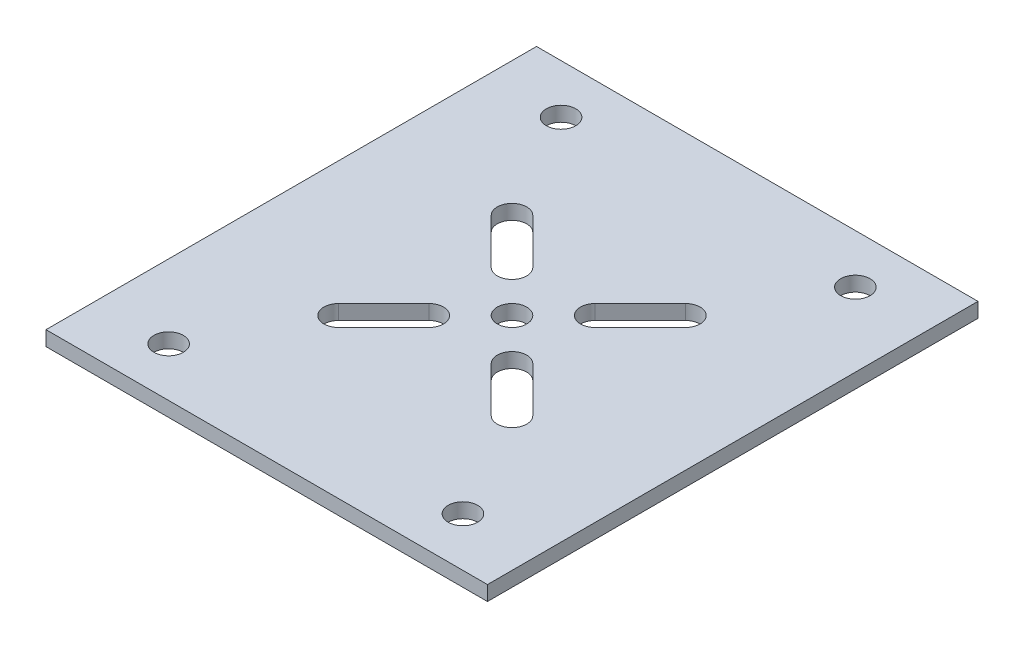
from build123d import *

# Parameters (mm, degrees)
SKETCH2_W           = 45
SKETCH2_H           = 50
BOSS_EXTRUDE1_DEPTH = 1.5
SKETCH3_R           = 1.5
CUT_EXTRUDE1_DEPTH  = 34.667491739
SKETCH4_R           = 1.5
CUT_EXTRUDE2_DEPTH  = 34.667491739


with BuildPart() as part:
    # Sketch2 → Boss-Extrude1 (new body)
    with BuildSketch(Plane(origin=(0, 0, 0), x_dir=(1, 0, 0), z_dir=(0, 1, 0))):
        Rectangle(SKETCH2_W, SKETCH2_H)
    extrude(amount=BOSS_EXTRUDE1_DEPTH)

    # Sketch3 → Cut-Extrude1 (cut, through all)
    with BuildSketch(Plane(origin=(0, 1.5, 0), x_dir=(1, 0, 0), z_dir=(0, 1, 0))):
        Circle(SKETCH3_R)
        with BuildLine():
            Line((-7.778174593, 9.899494937), (-3.181980515, 5.303300859))
            ThreePointArc((-3.181980515, 5.303300859), (-3.181980515, 3.181980515), (-5.303300859, 3.181980515))
            Line((-5.303300859, 3.181980515), (-9.899494937, 7.778174593))
            ThreePointArc((-9.899494937, 7.778174593), (-9.899494937, 9.899494937), (-7.778174593, 9.899494937))
        make_face()
        with BuildLine():
            Line((-9.899494927, -7.778174583), (-5.303300849, -3.181980506))
            ThreePointArc((-5.303300849, -3.181980506), (-3.181980506, -3.181980506), (-3.181980506, -5.303300849))
            Line((-3.181980506, -5.303300849), (-7.778174583, -9.899494927))
            ThreePointArc((-7.778174583, -9.899494927), (-9.899494927, -9.899494927), (-9.899494927, -7.778174583))
        make_face()
        with BuildLine():
            Line((7.778174593, -9.899494917), (3.181980515, -5.303300839))
            ThreePointArc((3.181980515, -5.303300839), (3.181980515, -3.181980496), (5.303300859, -3.181980496))
            Line((5.303300859, -3.181980496), (9.899494937, -7.778174574))
            ThreePointArc((9.899494937, -7.778174574), (9.899494937, -9.899494917), (7.778174593, -9.899494917))
        make_face()
        with BuildLine():
            Line((9.899494927, 7.778174603), (5.303300849, 3.181980525))
            ThreePointArc((5.303300849, 3.181980525), (3.181980506, 3.181980525), (3.181980506, 5.303300869))
            Line((3.181980506, 5.303300869), (7.778174583, 9.899494946))
            ThreePointArc((7.778174583, 9.899494946), (9.899494927, 9.899494946), (9.899494927, 7.778174603))
        make_face()
    extrude(amount=-CUT_EXTRUDE1_DEPTH, mode=Mode.SUBTRACT)

    # Sketch4 → Cut-Extrude2 (cut, through all)
    with BuildSketch(Plane(origin=(0, 1.5, 0), x_dir=(1, 0, 0), z_dir=(0, 1, 0))):
        with Locations((15, -20)):
            Circle(SKETCH4_R)
        with Locations((-15, -20)):
            Circle(SKETCH4_R)
        with Locations((15, 20)):
            Circle(SKETCH4_R)
        with Locations((-15, 20)):
            Circle(SKETCH4_R)
    extrude(amount=-CUT_EXTRUDE2_DEPTH, mode=Mode.SUBTRACT)


solid = part.part
